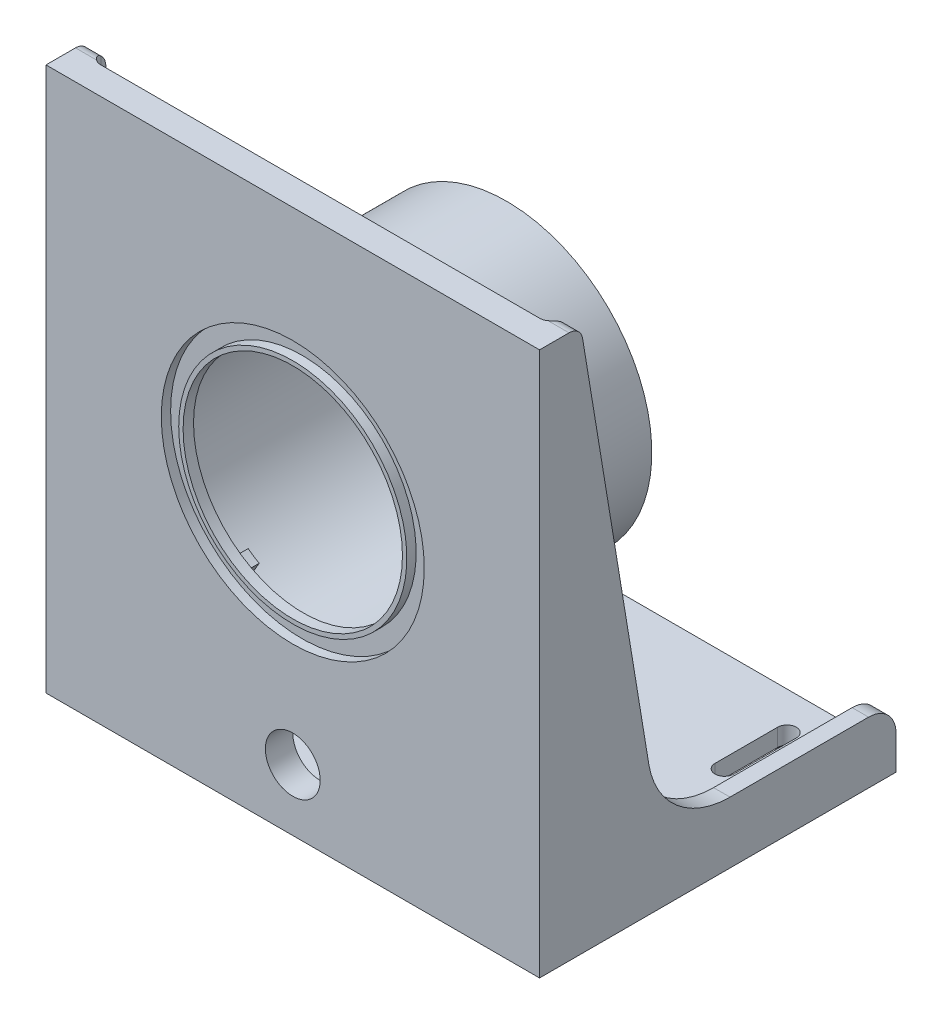
from build123d import *
from build123d.topology import SkipClean

# Parameters (mm, degrees)
SKETCH1_R                = 23.975
BOSS_EXTRUDE1_DEPTH      = 5
BOSS_EXTRUDE6_DEPTH      = 45
CUT_EXTRUDE3_DEPTH       = 42
BOSS_EXTRUDE3_DEPTH      = 10
CUT_EXTRUDE2_DEPTH       = 94.005376189
CIRPATTERN1_COUNT        = 3
SKETCH3_R                = 22.25
CUT_EXTRUDE1_DEPTH       = 94.005376189
BOSS_EXTRUDE4_START      = -0.2
SKETCH5_R                = 23.975
SKETCH5_R_2              = 20
BOSS_EXTRUDE4_DEPTH      = 0.2
SKETCH6_R                = 20.8
SKETCH6_R_2              = 20
BOSS_EXTRUDE5_DEPTH      = 1.7
SKETCH8_W                = 34
SKETCH8_H                = 2.5
M3_START                 = -55
M3_CLEARANCE_SLOT3_DEPTH = 4
SKETCH14_R               = 5
CUT_EXTRUDE4_DEPTH       = 97.306801421
FILLET3_R                = 2
CHAMFER1_SIZE            = 0.8


# Read off the part's stored shape, not the designer's step: M3 Clearance Slot3
with BuildPart() as part:
    # Sketch1 → Boss-Extrude1 (new body)
    with BuildSketch(Plane.XY):
        Polygon((-45, -45), (-45, -55), (45, -55), (45, -45), (45, 45), (-45, 45), align=None)
        Circle(SKETCH1_R, mode=Mode.SUBTRACT)
    extrude(amount=BOSS_EXTRUDE1_DEPTH)

    # Sketch9 → Boss-Extrude6 (add, symmetric)
    with BuildSketch(Plane(origin=(0, 0, 0), x_dir=(0, 0, -1), z_dir=(1, 0, 0))):
        with BuildLine():
            Line((0, 45), (0, -55))
            Line((0, -55), (60, -55))
            Line((60, -55), (60, -48))
            ThreePointArc((60, -48), (58.535533906, -44.464466094), (55, -43))
            Line((55, -43), (29.730670818, -43))
            ThreePointArc((29.730670818, -43), (20.024502844, -39.436358829), (14.930241511, -30.438707102))
            Line((14.930241511, -30.438707102), (2.844959748, 42.906451184))
            ThreePointArc((2.844959748, 42.906451184), (1.995916193, 44.406059805), (0.37822153, 45))
            Line((0.37822153, 45), (0, 45))
        make_face()
    extrude(amount=BOSS_EXTRUDE6_DEPTH, both=True)

    # Sketch10 → Cut-Extrude3 (cut, symmetric)
    with BuildSketch(Plane(origin=(0, 0, 0), x_dir=(0, 0, -1), z_dir=(1, 0, 0))):
        Polygon((0, 45), (0, -51), (62.788214541, -51), (2.5, 45), align=None)
    extrude(amount=CUT_EXTRUDE3_DEPTH, both=True, mode=Mode.SUBTRACT)

    # Sketch2 → Boss-Extrude3 (add)
    with BuildSketch(Plane.ZY.offset(-23.975)):
        Polygon((0, -2.4), (3.3, -2.4), (3.3, 14.5), (2.5, 14.5), (1.8, 0), (0, 0), align=None)
    boss_extrude3 = extrude(amount=BOSS_EXTRUDE3_DEPTH)

    # Sketch4 → Cut-Extrude2 (cut, through all)
    with BuildSketch(Plane.XY):
        with BuildLine():
            Line((16.63749335, 17.262515461), (0, 0))
            Line((0, 0), (19.359883897, 14.141977248))
            ThreePointArc((19.359883897, 14.141977248), (18.066190297, 15.761135529), (16.63749335, 17.262515461))
        make_face()
    cut_extrude2 = extrude(amount=CUT_EXTRUDE2_DEPTH, mode=Mode.SUBTRACT)

    # CirPattern1: Boss-Extrude3, Cut-Extrude2 ×3 about axis
    cirpattern1_axis = Axis((0, 0, 0), (0, 0, 1))
    add([boss_extrude3.rotate(cirpattern1_axis, i * 360 / CIRPATTERN1_COUNT) for i in range(1, CIRPATTERN1_COUNT)])
    add([cut_extrude2.rotate(cirpattern1_axis, i * 360 / CIRPATTERN1_COUNT) for i in range(1, CIRPATTERN1_COUNT)], mode=Mode.SUBTRACT)

    # Sketch3 → Cut-Extrude1 (cut, through all)
    with BuildSketch(Plane.XY):
        Circle(SKETCH3_R)
    extrude(amount=CUT_EXTRUDE1_DEPTH, mode=Mode.SUBTRACT)

    # Sketch5 → Boss-Extrude4 (add)
    with BuildSketch(Plane.XY.offset(3.3).offset(BOSS_EXTRUDE4_START)):
        with Locations(Location((0, 0, 0), (0, 0, 180))):
            Circle(SKETCH5_R)
        Circle(SKETCH5_R_2, mode=Mode.SUBTRACT)
    extrude(amount=BOSS_EXTRUDE4_DEPTH)

    # Sketch6 → Boss-Extrude5 (add)
    with BuildSketch(Plane.XY.offset(3.3)):
        with Locations(Location((0, 0, 0), (0, 0, 180))):
            Circle(SKETCH6_R)
        Circle(SKETCH6_R_2, mode=Mode.SUBTRACT)
    extrude(amount=BOSS_EXTRUDE5_DEPTH)

    # Sketch8 → Revolve1 (revolve)
    with SkipClean():  # the faces are left unmerged after this step: merging them gives an invalid solid
        with BuildSketch(Plane(origin=(0, 0, 0), x_dir=(0, 0, -1), z_dir=(1, 0, 0)), mode=Mode.PRIVATE) as revolve1_sk:
            with Locations((17, 25.225)):
                Rectangle(SKETCH8_W, SKETCH8_H)
        revolve(revolve1_sk.sketch.rotate(Axis((0, 0, 0), (0, 0, 1)), 90), axis=Axis((0, 0, 0), (0, 0, 1)))

    # M3 Clearance Slot3 outline → M3 Clearance Slot3 (cut)
    with SkipClean():  # the faces are left unmerged after this step: merging them gives an invalid solid
        with BuildSketch(Plane(origin=(0, 0, 0), x_dir=(1, 0, 0), z_dir=(0, 1, 0)).offset(M3_START)):
            with BuildLine():
                Line((33.7, 41.7), (33.7, 53.122760777))
                ThreePointArc((33.7, 53.122760777), (32, 54.822760777), (30.3, 53.122760777))
                Line((30.3, 53.122760777), (30.3, 41.7))
                ThreePointArc((30.3, 41.7), (32, 40), (33.7, 41.7))
            make_face()
            with BuildLine():
                Line((-30.3, 41.7), (-30.3, 53.122760777))
                ThreePointArc((-30.3, 53.122760777), (-32, 54.822760777), (-33.7, 53.122760777))
                Line((-33.7, 53.122760777), (-33.7, 41.7))
                ThreePointArc((-33.7, 41.7), (-32, 40), (-30.3, 41.7))
            make_face()
        extrude(amount=M3_CLEARANCE_SLOT3_DEPTH, mode=Mode.SUBTRACT)

    # Sketch14 → Cut-Extrude4 (cut, through all)
    with SkipClean():  # the faces are left unmerged after this step: merging them gives an invalid solid
        with BuildSketch(Plane.XY.offset(5)):
            with Locations((0, -43)):
                Circle(SKETCH14_R)
        extrude(amount=-CUT_EXTRUDE4_DEPTH, mode=Mode.SUBTRACT)

    # Fillet3
    fillet3_edges = [part.edges().sort_by_distance(p)[0] for p in [
        (42, -3, 0),
        (0, -51, 0),
        (-42, -3, 0),
        (42, -51, -30),
        (-42, -51, -30),
    ]]
    fillet(fillet3_edges, radius=FILLET3_R)

    # Chamfer1
    chamfer1_edges = [part.edges().sort_by_distance(p)[0] for p in [
        (45, -55, -27.5),
        (-45, -55, -27.5),
        (0, -55, 5),
        (0, -55, -60),
        (32, -55, -54.822760777),
        (32, -55, -40),
        (30.3, -55, -47.411380389),
        (33.7, -55, -47.411380389),
        (-33.7, -55, -47.411380389),
        (-32, -55, -54.822760777),
        (-32, -55, -40),
        (-30.3, -55, -47.411380389),
    ]]
    chamfer(chamfer1_edges, length=CHAMFER1_SIZE)


solid = part.part
